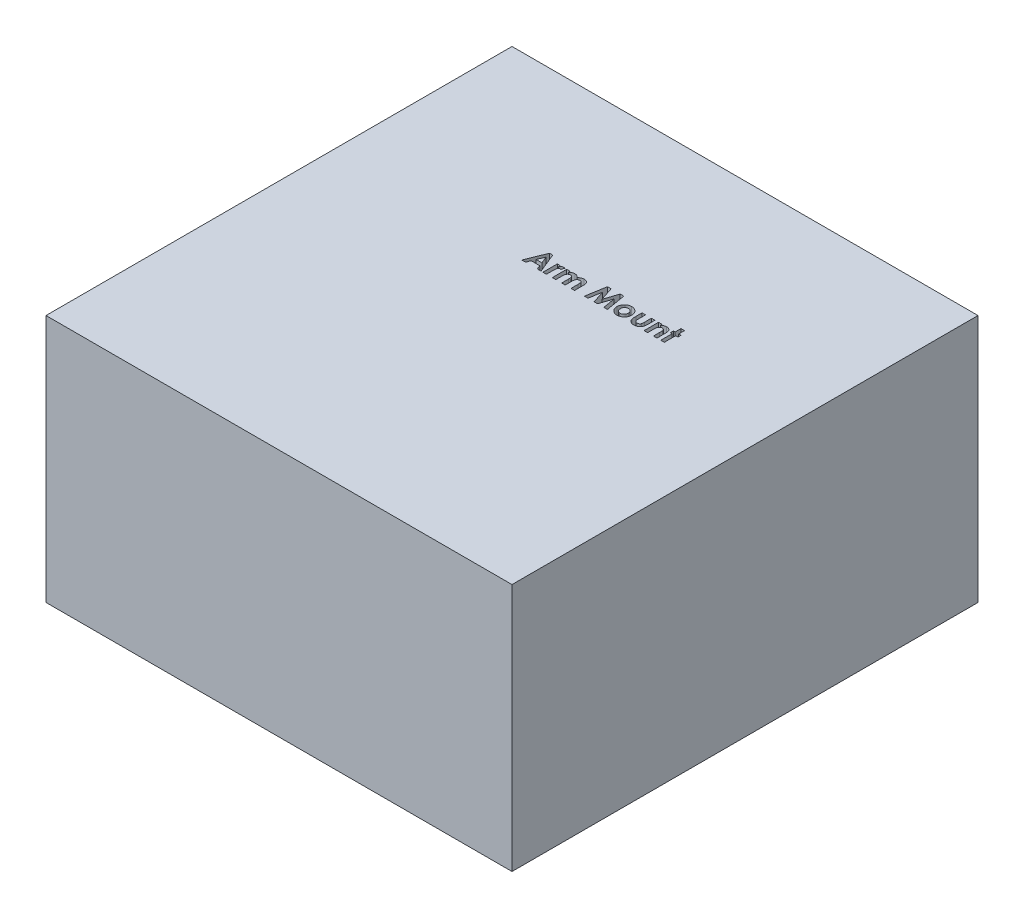
from build123d import *

# Parameters (mm, degrees)
SKETCH1_W           = 300
SKETCH1_H           = 300
BOSS_EXTRUDE1_DEPTH = 160
CUT_EXTRUDE1_DEPTH  = 160


with BuildPart() as part:
    # Sketch1 → Boss-Extrude1 (new body)
    with BuildSketch(Plane(origin=(0, 0, 0), x_dir=(1, 0, 0), z_dir=(0, 1, 0))):
        with Locations((150, 150)):
            Rectangle(SKETCH1_W, SKETCH1_H)
    extrude(amount=BOSS_EXTRUDE1_DEPTH)

    # Sketch2 → Cut-Extrude1 (cut)
    # profile 1 of 8: a face of its own
    with BuildSketch(Plane(origin=(0, 160, 0), x_dir=(1, 0, 0), z_dir=(0, 1, 0))):
        Polygon((127.3448054, 196.797186132), (129.458927996, 196.797186132), (134.58777415, 184.097186132), (132.153098669, 184.097186132), (131.16599931, 186.702314337), (125.632645945, 186.702314337), (124.645546586, 184.097186132), (122.213415176, 184.097186132), align=None)
        Polygon((128.400594663, 193.390675716), (126.497629919, 188.981801517), (130.303559407, 188.981801517), align=None, mode=Mode.SUBTRACT)
    # profile 2 of 8: a face of its own
    with BuildSketch(Plane(origin=(0, 160, 0), x_dir=(1, 0, 0), z_dir=(0, 1, 0))):
        with BuildLine():
            Line((135.808927996, 193.377955363), (137.76277415, 193.377955363))
            Line((137.76277415, 193.377955363), (137.76277415, 192.235667703))
            add(Edge.make_bspline(
                [(137.76277415, 192.235667703), (137.818044707, 192.337183121), (137.926073303, 192.535599219), (138.124530895, 192.801933536), (138.352527014, 193.026232868), (138.601869055, 193.213188638), (138.873312725, 193.358902303), (139.159589247, 193.46274166), (139.458249528, 193.530222852), (139.661985448, 193.537232872), (139.764957644, 193.540775876)],
                knots=[0, 0, 0, 0, 1.09866127, 2.147379032, 3.14564304, 4.131443017, 5.102343063, 6.064490016, 7.021754664, 8, 8, 8, 8], degree=3))
            add(Edge.make_bspline(
                [(139.764957644, 193.540775876), (139.839728307, 193.537274648), (139.991988075, 193.530144898), (140.224053389, 193.48869955), (140.459466997, 193.413758482), (140.614389438, 193.34628401), (140.693543381, 193.31180953)],
                knots=[0, 0, 0, 0, 0.931404136, 1.896671404, 2.925354185, 4, 4, 4, 4], degree=3))
            Line((140.693543381, 193.31180953), (139.986291778, 191.380860011))
            add(Edge.make_bspline(
                [(139.986291778, 191.380860011), (139.923073585, 191.411403985), (139.804247716, 191.468814899), (139.631733188, 191.536565693), (139.475169101, 191.577903916), (139.375910343, 191.584071941), (139.329921586, 191.586929722)],
                knots=[0, 0, 0, 0, 1.214386998, 2.282580073, 3.20428172, 4, 4, 4, 4], degree=3))
            add(Edge.make_bspline(
                [(139.329921586, 191.586929722), (139.286499256, 191.585036005), (139.201080051, 191.581310738), (139.075003695, 191.549386464), (138.956266021, 191.494334041), (138.839145068, 191.423806424), (138.73288038, 191.325767762), (138.626681329, 191.212270603), (138.533093039, 191.072143265), (138.434330252, 190.91617442), (138.35023727, 190.725268695), (138.278130127, 190.4973666), (138.213882084, 190.229831152), (138.169670659, 189.921241868), (138.126938541, 189.574584882), (138.101503335, 189.187315775), (138.082546155, 188.760659129), (138.08138705, 188.462837392), (138.080782964, 188.307622831)],
                knots=[0, 0, 0, 0, 0.544232178, 1.070598461, 1.618251235, 2.182094276, 2.777567932, 3.425210017, 4.127676488, 4.886675562, 5.738955394, 6.734782583, 7.883056018, 9.186093582, 10.642914445, 12.264202625, 14.053029461, 16, 16, 16, 16], degree=3))
            Line((138.080782964, 188.307622831), (138.088415176, 187.85477828))
            Line((138.088415176, 187.85477828), (138.088415176, 184.097186132))
            Line((138.088415176, 184.097186132), (135.808927996, 184.097186132))
            Line((135.808927996, 184.097186132), (135.808927996, 193.377955363))
        make_face()
    # profile 3 of 8: a face of its own
    with BuildSketch(Plane(origin=(0, 160, 0), x_dir=(1, 0, 0), z_dir=(0, 1, 0))):
        with BuildLine():
            Line((141.833286971, 193.377955363), (144.11277415, 193.377955363))
            Line((144.11277415, 193.377955363), (144.11277415, 192.26874062))
            add(Edge.make_bspline(
                [(144.11277415, 192.26874062), (144.214164582, 192.371072702), (144.413794008, 192.572556161), (144.744619019, 192.831581261), (145.089703004, 193.053079723), (145.453227834, 193.232396668), (145.834304342, 193.369318106), (146.231126425, 193.469652117), (146.645732325, 193.528846041), (146.928022906, 193.536755184), (147.071528157, 193.540775876)],
                knots=[0, 0, 0, 0, 1.041528618, 2.050684245, 3.032913108, 4.004406485, 4.976926473, 5.95771665, 6.961784757, 8, 8, 8, 8], degree=3))
            add(Edge.make_bspline(
                [(147.071528157, 193.540775876), (147.215222885, 193.536256037), (147.498081309, 193.52735888), (147.910769782, 193.445941555), (148.301726174, 193.313665913), (148.666649046, 193.125123238), (149.008175847, 192.892282835), (149.311176713, 192.603115435), (149.583913906, 192.269132165), (149.729293329, 192.016637222), (149.803859887, 191.887130043)],
                knots=[0, 0, 0, 0, 1.023965777, 2.015643508, 2.987309376, 3.958410333, 4.93654923, 5.924956801, 6.93568961, 8, 8, 8, 8], degree=3))
            add(Edge.make_bspline(
                [(149.803859887, 191.887130043), (149.89991125, 192.016989531), (150.088433122, 192.271867264), (150.42260531, 192.604639043), (150.783945146, 192.892312988), (151.179443725, 193.126842229), (151.598597974, 193.313022353), (152.039573727, 193.445450078), (152.498372951, 193.527222809), (152.810611, 193.536220656), (152.968683605, 193.540775876)],
                knots=[0, 0, 0, 0, 1.041189987, 2.043563759, 3.033412161, 4.015238574, 5.00275396, 5.986226558, 6.980513695, 8, 8, 8, 8], degree=3))
            add(Edge.make_bspline(
                [(152.968683605, 193.540775876), (153.131953835, 193.536045982), (153.449907431, 193.526834954), (153.910667849, 193.436214558), (154.342225738, 193.29619245), (154.735043787, 193.092426013), (155.090242353, 192.851056598), (155.39291438, 192.565868562), (155.644104507, 192.246813334), (155.807661492, 191.9488936), (155.913396688, 191.68549844), (155.977240539, 191.456295298), (156.036954292, 191.200361001), (156.079852648, 190.914255432), (156.119896371, 190.600667761), (156.143143327, 190.257513153), (156.158944524, 189.885947615), (156.160622811, 189.628863443), (156.161492099, 189.495703761)],
                knots=[0, 0, 0, 0, 1.321991808, 2.574456155, 3.791773975, 4.987670122, 6.148905103, 7.262530793, 8.344737981, 9.427709016, 10.004683293, 10.642050061, 11.354108788, 12.133887687, 12.985666279, 13.916212488, 14.92067847, 16, 16, 16, 16], degree=3))
            Line((156.161492099, 189.495703761), (156.161492099, 184.097186132))
            Line((156.161492099, 184.097186132), (153.882004919, 184.097186132))
            Line((153.882004919, 184.097186132), (153.882004919, 188.757923312))
            add(Edge.make_bspline(
                [(153.882004919, 188.757923312), (153.880107678, 188.882589368), (153.876466095, 189.121874597), (153.860984321, 189.465083575), (153.82632949, 189.7763445), (153.785709586, 190.057381467), (153.72758172, 190.306704386), (153.656705343, 190.524914281), (153.574489176, 190.712325258), (153.475215633, 190.868917783), (153.364029147, 191.000793424), (153.240350222, 191.113836965), (153.105468398, 191.210285475), (152.958160775, 191.292494122), (152.794568269, 191.348093459), (152.620213506, 191.391718682), (152.433732107, 191.421427771), (152.30479891, 191.42319894), (152.238535368, 191.424109209)],
                knots=[0, 0, 0, 0, 1.669139205, 3.203761885, 4.596586177, 5.860166715, 7.002923539, 8.018877315, 8.928339525, 9.734594377, 10.491888885, 11.231098709, 11.971440889, 12.708030942, 13.480072485, 14.275788656, 15.113863979, 16, 16, 16, 16], degree=3))
            add(Edge.make_bspline(
                [(152.238535368, 191.424109209), (152.136424189, 191.420578961), (151.936051319, 191.413651552), (151.644067208, 191.347452397), (151.369308009, 191.239223864), (151.112803081, 191.091988531), (150.880071842, 190.908094383), (150.676490922, 190.689978388), (150.508361473, 190.436383526), (150.39197817, 190.201098362), (150.319253224, 189.988353297), (150.267952385, 189.806154234), (150.22796542, 189.600114043), (150.196667335, 189.372319435), (150.166640476, 189.121482665), (150.151909467, 188.847920923), (150.13683515, 188.552014254), (150.137031386, 188.347504678), (150.137133125, 188.241476998)],
                knots=[0, 0, 0, 0, 1.129913425, 2.217230253, 3.297175357, 4.391411011, 5.481605898, 6.571841268, 7.681894157, 8.841607612, 9.468549532, 10.170608623, 10.93710061, 11.791434153, 12.717934886, 13.734733707, 14.825576123, 16, 16, 16, 16], degree=3))
            Line((150.137133125, 188.241476998), (150.137133125, 184.097186132))
            Line((150.137133125, 184.097186132), (147.857645945, 184.097186132))
            Line((147.857645945, 184.097186132), (147.857645945, 188.546765459))
            add(Edge.make_bspline(
                [(147.857645945, 188.546765459), (147.857454559, 188.645996937), (147.857086393, 188.836886157), (147.846020075, 189.112533843), (147.831366108, 189.367056681), (147.810822953, 189.601164578), (147.787130468, 189.814566362), (147.752936753, 190.006094578), (147.717013101, 190.176804604), (147.655421513, 190.370726099), (147.568631046, 190.585623569), (147.438964819, 190.81351037), (147.282180641, 191.00431186), (147.102241223, 191.159512881), (146.898901959, 191.277763605), (146.677314067, 191.365727447), (146.433246463, 191.413207629), (146.265246642, 191.420398664), (146.178559407, 191.424109209)],
                knots=[0, 0, 0, 0, 1.256487322, 2.417074606, 3.49288742, 4.484586665, 5.393016842, 6.210437544, 6.947749329, 7.599905853, 8.784490193, 9.876739139, 10.906602197, 11.896672079, 12.869113195, 13.872201355, 14.902064413, 16, 16, 16, 16], degree=3))
            add(Edge.make_bspline(
                [(146.178559407, 191.424109209), (146.08061029, 191.420784646), (145.886621245, 191.414200322), (145.604046566, 191.343479295), (145.333878968, 191.237236553), (145.082061861, 191.085894605), (144.852836733, 190.897672865), (144.65129409, 190.673352745), (144.484048226, 190.413200323), (144.367148319, 190.171425152), (144.29548379, 189.953372391), (144.242803546, 189.766442357), (144.20430435, 189.555864698), (144.172182718, 189.324003826), (144.142333629, 189.070586055), (144.127541668, 188.794496954), (144.112482246, 188.496042544), (144.112674504, 188.289838596), (144.11277415, 188.182963376)],
                knots=[0, 0, 0, 0, 1.07893236, 2.136834559, 3.195274846, 4.273923004, 5.364443877, 6.458052972, 7.587287137, 8.767908, 9.410170275, 10.118584836, 10.909717261, 11.770069756, 12.702352573, 13.724628867, 14.820678298, 16, 16, 16, 16], degree=3))
            Line((144.11277415, 188.182963376), (144.11277415, 184.097186132))
            Line((144.11277415, 184.097186132), (141.833286971, 184.097186132))
            Line((141.833286971, 184.097186132), (141.833286971, 193.377955363))
        make_face()
    # profile 4 of 8: a face of its own
    with BuildSketch(Plane(origin=(0, 160, 0), x_dir=(1, 0, 0), z_dir=(0, 1, 0))):
        Polygon((164.656143541, 196.797186132), (167.022129118, 196.797186132), (169.919825432, 187.938732607), (172.83787431, 196.797186132), (175.180963253, 196.797186132), (177.328158766, 184.097186132), (175.02068681, 184.097186132), (173.664697227, 192.118640459), (171.023952035, 184.097186132), (168.800434407, 184.097186132), (166.174953637, 192.118640459), (164.821508125, 184.097186132), (162.511492099, 184.097186132), align=None)
    # profile 5 of 8: a face of its own
    with BuildSketch(Plane(origin=(0, 160, 0), x_dir=(1, 0, 0), z_dir=(0, 1, 0))):
        with BuildLine():
            add(Edge.make_bspline(
                [(183.540778958, 193.540775876), (183.648548711, 193.538858039), (183.861981655, 193.535059854), (184.179863363, 193.50344343), (184.492187765, 193.451859931), (184.800750061, 193.385068303), (185.102684962, 193.291483243), (185.399576079, 193.179242434), (185.694077997, 193.050376859), (185.978881236, 192.896981751), (186.256043287, 192.730610766), (186.518809407, 192.54708992), (186.764997503, 192.347860704), (186.999177665, 192.137542407), (187.21043672, 191.906978456), (187.412275254, 191.667278387), (187.593788423, 191.409854585), (187.761843471, 191.140979873), (187.911461671, 190.862209099), (188.041377562, 190.575481494), (188.154132341, 190.284761268), (188.242417073, 189.986507251), (188.315508693, 189.684652317), (188.361634701, 189.375497461), (188.394427094, 189.06221848), (188.398104161, 188.851293289), (188.399953637, 188.745202959)],
                knots=[0, 0, 0, 0, 1.022364134, 2.024744242, 3.027414945, 4.024939316, 5.017584196, 6.023349371, 7.035562955, 8.064994934, 9.090267829, 10.101425541, 11.102933353, 12.093946398, 13.084502048, 14.067315274, 15.065326281, 16.070028806, 17.074376865, 18.064572984, 19.055292013, 20.030201733, 21.013838017, 21.999348303, 22.993720005, 24, 24, 24, 24], degree=3))
            add(Edge.make_bspline(
                [(188.399953637, 188.745202959), (188.398001821, 188.638283798), (188.394121168, 188.425704268), (188.362821089, 188.109478511), (188.311040145, 187.798869844), (188.243992168, 187.492048418), (188.150757329, 187.192940308), (188.041822372, 186.897136541), (187.908100427, 186.608669034), (187.760260963, 186.324390878), (187.591125392, 186.05266751), (187.409769344, 185.792664943), (187.208776209, 185.551204265), (186.999208341, 185.320797108), (186.771125464, 185.109234811), (186.528168204, 184.913082167), (186.272439898, 184.729941122), (186.002101589, 184.56410851), (185.720615859, 184.418397307), (185.432729913, 184.287026767), (185.136760353, 184.177651412), (184.833319704, 184.088458822), (184.522223941, 184.019399232), (184.204159881, 183.972486231), (183.879812518, 183.93985878), (183.661280036, 183.936208461), (183.55095524, 183.93436562)],
                knots=[0, 0, 0, 0, 1.012026251, 2.012137606, 3.004615893, 3.992048833, 4.982446996, 5.968083444, 6.973977695, 7.990229942, 8.999482246, 10.001782172, 10.988562221, 11.971415814, 12.948383116, 13.930088534, 14.925840678, 15.924049238, 16.929462851, 17.924729459, 18.917889337, 19.913673841, 20.916777188, 21.931792057, 22.95587778, 24, 24, 24, 24], degree=3))
            add(Edge.make_bspline(
                [(183.55095524, 183.93436562), (183.389637891, 183.939100602), (183.07167894, 183.948433324), (182.603400579, 184.012360029), (182.153539656, 184.12239465), (181.721363127, 184.275780484), (181.306309584, 184.472338715), (180.912001283, 184.715609375), (180.534515932, 185.000803161), (180.18039186, 185.32550959), (179.855966238, 185.681741947), (179.572541424, 186.062017817), (179.33189082, 186.460637504), (179.134230941, 186.878055569), (178.98167782, 187.314844406), (178.871508438, 187.769698167), (178.807503575, 188.243895382), (178.798249786, 188.566078648), (178.793543381, 188.729938536)],
                knots=[0, 0, 0, 0, 1.029999031, 2.030143771, 3.011211297, 3.982305373, 4.953580601, 5.938004764, 6.935448627, 7.970290061, 9.001484052, 10.007591832, 10.993831261, 11.969999897, 12.951306496, 13.942897864, 14.953773953, 16, 16, 16, 16], degree=3))
            add(Edge.make_bspline(
                [(178.793543381, 188.729938536), (178.798413912, 188.904904976), (178.807986844, 189.248798011), (178.884000136, 189.752609144), (179.005385162, 190.234984428), (179.179625721, 190.694574504), (179.402202711, 191.132227027), (179.673918772, 191.547018937), (179.996116743, 191.93904419), (180.242855871, 192.176154503), (180.368323028, 192.296725395)],
                knots=[0, 0, 0, 0, 1.043912699, 2.05178951, 3.033892, 4.007821512, 4.978932272, 5.95884105, 6.962068106, 8, 8, 8, 8], degree=3))
            add(Edge.make_bspline(
                [(180.368323028, 192.296725395), (180.483451686, 192.396665103), (180.710576696, 192.593825457), (181.079580083, 192.843891044), (181.457397914, 193.05987142), (181.848558495, 193.23744746), (182.254152284, 193.371336929), (182.672100841, 193.468796483), (183.102317261, 193.528658997), (183.393882322, 193.536716391), (183.540778958, 193.540775876)],
                knots=[0, 0, 0, 0, 1.048115528, 2.067714963, 3.060638214, 4.039924844, 5.017819947, 5.994373833, 6.98952318, 8, 8, 8, 8], degree=3))
        make_face()
        with BuildLine():
            add(Edge.make_bspline(
                [(183.591660368, 191.424109209), (183.50340488, 191.421175889), (183.329673001, 191.415401617), (183.073935112, 191.38441264), (182.832055523, 191.320898071), (182.599230054, 191.240124922), (182.379577413, 191.132102216), (182.167082094, 191.005690756), (181.972793387, 190.847502369), (181.78730904, 190.673981281), (181.618930598, 190.48129077), (181.475456176, 190.271354603), (181.347258602, 190.052204497), (181.250052882, 189.815817093), (181.169605857, 189.568653546), (181.115160275, 189.306720445), (181.077269952, 189.032943724), (181.074457132, 188.845404794), (181.07303056, 188.7502911)],
                knots=[0, 0, 0, 0, 1.030650113, 2.02884584, 2.99876339, 3.944280128, 4.900564847, 5.851248946, 6.823638398, 7.81794922, 8.81432732, 9.802856497, 10.78262424, 11.771747962, 12.779760563, 13.812642396, 14.89064281, 16, 16, 16, 16], degree=3))
            add(Edge.make_bspline(
                [(181.07303056, 188.7502911), (181.074699843, 188.651823219), (181.077962135, 188.459386655), (181.111743852, 188.178403394), (181.167451017, 187.911752142), (181.24659344, 187.659844817), (181.3461284, 187.42087326), (181.468246253, 187.196178262), (181.614235817, 186.987110828), (181.779752549, 186.793928408), (181.960986301, 186.618574589), (182.159568078, 186.468092502), (182.367182023, 186.337343541), (182.588612688, 186.232331945), (182.820715123, 186.151254472), (183.064178344, 186.091559857), (183.32028175, 186.059399292), (183.4949038, 186.053859638), (183.584028157, 186.051032286)],
                knots=[0, 0, 0, 0, 1.141730614, 2.231293227, 3.276944405, 4.297399982, 5.28939179, 6.275415646, 7.257752684, 8.24146775, 9.222424823, 10.176631434, 11.126518621, 12.063689483, 13.012557477, 13.974037417, 14.965980454, 16, 16, 16, 16], degree=3))
            add(Edge.make_bspline(
                [(183.584028157, 186.051032286), (183.673197089, 186.05354002), (183.84801996, 186.058456634), (184.104424112, 186.095274307), (184.349130635, 186.153218067), (184.583215406, 186.234993345), (184.804785829, 186.342252658), (185.014690093, 186.47362714), (185.214774753, 186.626202297), (185.39844068, 186.80486471), (185.568456716, 186.998649596), (185.717550611, 187.208820683), (185.842139092, 187.433515738), (185.944323955, 187.671320979), (186.023621525, 187.921909544), (186.078406446, 188.186212839), (186.116317028, 188.463411768), (186.119066233, 188.653483667), (186.120466458, 188.7502911)],
                knots=[0, 0, 0, 0, 1.031504075, 2.022346795, 2.991027682, 3.937587355, 4.885570121, 5.833146507, 6.798790848, 7.791235734, 8.792807298, 9.778388351, 10.766749885, 11.760164525, 12.768777521, 13.802286646, 14.880660483, 16, 16, 16, 16], degree=3))
            add(Edge.make_bspline(
                [(186.120466458, 188.7502911), (186.11877594, 188.847064698), (186.115458596, 189.036965891), (186.081674471, 189.314539728), (186.026514001, 189.577988721), (185.946350815, 189.826187964), (185.847407477, 190.061969018), (185.725205217, 190.284125007), (185.578495678, 190.491561756), (185.412174323, 190.683250678), (185.228223764, 190.856143885), (185.033089845, 191.010322655), (184.822310454, 191.137840343), (184.59983994, 191.242960438), (184.365086413, 191.323835345), (184.118313424, 191.383868266), (183.858764691, 191.4155712), (183.681625663, 191.421233462), (183.591660368, 191.424109209)],
                knots=[0, 0, 0, 0, 1.123894411, 2.205445421, 3.243160173, 4.246488011, 5.231014757, 6.210004299, 7.185865357, 8.177612767, 9.153374344, 10.115157457, 11.061423229, 12.009021698, 12.96873347, 13.94135618, 14.954456845, 16, 16, 16, 16], degree=3))
        make_face(mode=Mode.SUBTRACT)
    # profile 6 of 8: a face of its own
    with BuildSketch(Plane(origin=(0, 160, 0), x_dir=(1, 0, 0), z_dir=(0, 1, 0))):
        with BuildLine():
            Line((190.353799791, 193.377955363), (192.633286971, 193.377955363))
            Line((192.633286971, 193.377955363), (192.633286971, 188.923287895))
            add(Edge.make_bspline(
                [(192.633286971, 188.923287895), (192.63348939, 188.818970336), (192.633877883, 188.618759464), (192.644688368, 188.331217456), (192.659857615, 188.068273456), (192.67878781, 187.829617406), (192.707042338, 187.615823353), (192.739661, 187.427299435), (192.77664004, 187.262687316), (192.836772628, 187.079205161), (192.930851149, 186.878419233), (193.072926367, 186.66526139), (193.245020897, 186.480942183), (193.444809623, 186.323825874), (193.674332881, 186.200014772), (193.930428441, 186.116109878), (194.209874098, 186.059717065), (194.404507581, 186.054003508), (194.505722868, 186.051032286)],
                knots=[0, 0, 0, 0, 1.267339619, 2.432334223, 3.495366327, 4.467371443, 5.340232306, 6.114347373, 6.791623365, 7.387877112, 8.457231658, 9.474542289, 10.487879852, 11.508108106, 12.54995813, 13.638205937, 14.771795776, 16, 16, 16, 16], degree=3))
            add(Edge.make_bspline(
                [(194.505722868, 186.051032286), (194.606848336, 186.054423516), (194.801985173, 186.060967404), (195.08329009, 186.111998387), (195.339988855, 186.199441676), (195.574717927, 186.318048178), (195.780555133, 186.476782779), (195.959769169, 186.665926317), (196.110663182, 186.888529909), (196.183174714, 187.054585811), (196.220426394, 187.139894466)],
                knots=[0, 0, 0, 0, 1.116871431, 2.155171802, 3.144773418, 4.104381479, 5.046960687, 6.001340237, 6.973219418, 8, 8, 8, 8], degree=3))
            add(Edge.make_bspline(
                [(196.220426394, 187.139894466), (196.234096509, 187.177789335), (196.264271711, 187.261437889), (196.291128237, 187.405743155), (196.320033858, 187.575927852), (196.34289923, 187.775460201), (196.355837264, 188.003104477), (196.369699043, 188.259147592), (196.376763255, 188.543334543), (196.377679351, 188.742656176), (196.378158766, 188.84696578)],
                knots=[0, 0, 0, 0, 0.56094539, 1.238222264, 2.041156151, 2.969685991, 4.036367568, 5.220421584, 6.545382566, 8, 8, 8, 8], degree=3))
            Line((196.378158766, 188.84696578), (196.378158766, 193.377955363))
            Line((196.378158766, 193.377955363), (198.657645945, 193.377955363))
            Line((198.657645945, 193.377955363), (198.657645945, 189.477895267))
            add(Edge.make_bspline(
                [(198.657645945, 189.477895267), (198.657251254, 189.284522017), (198.656494512, 188.913766968), (198.634806749, 188.381930899), (198.604875178, 187.898385762), (198.566329073, 187.461800203), (198.510788898, 187.071993036), (198.442610374, 186.729878372), (198.367183159, 186.433195469), (198.298013592, 186.257408798), (198.265859086, 186.175691741)],
                knots=[0, 0, 0, 0, 1.388070971, 2.661352173, 3.82033814, 4.865898334, 5.806910977, 6.645039373, 7.370126333, 8, 8, 8, 8], degree=3))
            add(Edge.make_bspline(
                [(198.265859086, 186.175691741), (198.224645292, 186.087738941), (198.143292802, 185.914127669), (198.002131111, 185.667290889), (197.8499509, 185.433432595), (197.679511378, 185.218057582), (197.494291744, 185.01897691), (197.299527574, 184.83166499), (197.086447703, 184.663749446), (196.860578078, 184.510909338), (196.618767002, 184.375234463), (196.362670705, 184.255003543), (196.089521659, 184.15715619), (195.80168839, 184.074216758), (195.497844174, 184.012364558), (195.178601071, 183.965516235), (194.843608948, 183.941304843), (194.615150525, 183.936716594), (194.498090657, 183.93436562)],
                knots=[0, 0, 0, 0, 0.997311338, 1.968606903, 2.91805772, 3.860812155, 4.785445165, 5.709667791, 6.633356648, 7.568312411, 8.508286151, 9.478643871, 10.470653671, 11.485274776, 12.552984541, 13.653035246, 14.797438149, 16, 16, 16, 16], degree=3))
            add(Edge.make_bspline(
                [(194.498090657, 183.93436562), (194.371633105, 183.93587266), (194.124198558, 183.938821427), (193.762700141, 183.974932265), (193.41818729, 184.021654996), (193.094506469, 184.101092202), (192.787137326, 184.193124178), (192.49960863, 184.31058146), (192.230745468, 184.448677943), (191.980018816, 184.606594916), (191.749373217, 184.785779518), (191.533680011, 184.97848632), (191.339902698, 185.192382514), (191.161715241, 185.420862902), (191.001106309, 185.666030301), (190.857996188, 185.927012968), (190.732263656, 186.204997987), (190.665179113, 186.399825791), (190.631103477, 186.498788696)],
                knots=[0, 0, 0, 0, 1.211240017, 2.369985978, 3.478996442, 4.539426614, 5.559871561, 6.551301256, 7.510778031, 8.453136967, 9.386094087, 10.30661716, 11.221130616, 12.147659962, 13.080758632, 14.026335491, 14.997475882, 16, 16, 16, 16], degree=3))
            add(Edge.make_bspline(
                [(190.631103477, 186.498788696), (190.607855968, 186.575647077), (190.557775412, 186.741217945), (190.503703757, 187.016377402), (190.460455281, 187.333514083), (190.41838453, 187.692939937), (190.389035206, 188.09525754), (190.369852139, 188.539827961), (190.356890734, 189.027520554), (190.354860459, 189.366795211), (190.353799791, 189.5440411)],
                knots=[0, 0, 0, 0, 0.627914866, 1.352675004, 2.190563461, 3.132055958, 4.183353232, 5.345633452, 6.613289997, 8, 8, 8, 8], degree=3))
            Line((190.353799791, 189.5440411), (190.353799791, 193.377955363))
        make_face()
    # profile 7 of 8: a face of its own
    with BuildSketch(Plane(origin=(0, 160, 0), x_dir=(1, 0, 0), z_dir=(0, 1, 0))):
        with BuildLine():
            Line((200.937133125, 193.377955363), (203.216620304, 193.377955363))
            Line((203.216620304, 193.377955363), (203.216620304, 192.395944145))
            add(Edge.make_bspline(
                [(203.216620304, 192.395944145), (203.346663918, 192.497094746), (203.595202543, 192.690413208), (203.973024166, 192.936895232), (204.329640999, 193.138630871), (204.673002416, 193.292081321), (205.009568768, 193.402482322), (205.344790991, 193.481798855), (205.683661221, 193.532587411), (205.911464272, 193.538047852), (206.02527415, 193.540775876)],
                knots=[0, 0, 0, 0, 1.276643801, 2.439914479, 3.493451431, 4.44993799, 5.350072675, 6.235028322, 7.118224225, 8, 8, 8, 8], degree=3))
            add(Edge.make_bspline(
                [(206.02527415, 193.540775876), (206.140718956, 193.53765831), (206.367346806, 193.531538265), (206.701043827, 193.488733512), (207.019858923, 193.410772497), (207.327376908, 193.307261355), (207.620467775, 193.170632584), (207.902722065, 193.008408087), (208.168077056, 192.810807673), (208.331494407, 192.660324684), (208.414156362, 192.584205363)],
                knots=[0, 0, 0, 0, 1.048836932, 2.058954983, 3.049370783, 4.026390553, 5.001981509, 5.982488534, 6.97947532, 8, 8, 8, 8], degree=3))
            add(Edge.make_bspline(
                [(208.414156362, 192.584205363), (208.480454292, 192.513665011), (208.613535374, 192.372068036), (208.781001194, 192.129759345), (208.924705706, 191.86559852), (209.042451584, 191.576538381), (209.129461046, 191.260990729), (209.196398611, 190.92276693), (209.233958447, 190.559973178), (209.238595385, 190.310737295), (209.240979278, 190.182602799)],
                knots=[0, 0, 0, 0, 0.889584746, 1.785680191, 2.700364693, 3.65222533, 4.649950538, 5.707241244, 6.821271309, 8, 8, 8, 8], degree=3))
            Line((209.240979278, 190.182602799), (209.240979278, 184.097186132))
            Line((209.240979278, 184.097186132), (206.961492099, 184.097186132))
            Line((206.961492099, 184.097186132), (206.961492099, 188.126993825))
            add(Edge.make_bspline(
                [(206.961492099, 188.126993825), (206.961010038, 188.258439131), (206.960086257, 188.510329664), (206.952993664, 188.870822873), (206.939144791, 189.196395054), (206.926521905, 189.487638982), (206.90173816, 189.743520545), (206.879387779, 189.965659669), (206.845093285, 190.15204109), (206.800470586, 190.352522274), (206.722548362, 190.567174043), (206.601577909, 190.793345143), (206.448109925, 190.985482536), (206.268412657, 191.144933198), (206.062684563, 191.271073297), (205.833411571, 191.359820714), (205.581822856, 191.415130283), (205.406518796, 191.421040084), (205.315478477, 191.424109209)],
                knots=[0, 0, 0, 0, 1.49886392, 2.872294502, 4.110984203, 5.214877267, 6.195405875, 7.042225351, 7.75923308, 8.355011229, 9.382752534, 10.352059385, 11.267231453, 12.171456522, 13.078624015, 14.003401117, 14.963110155, 16, 16, 16, 16], degree=3))
            add(Edge.make_bspline(
                [(205.315478477, 191.424109209), (205.197076713, 191.418105024), (204.965459844, 191.406359671), (204.630472379, 191.317788991), (204.322791974, 191.167156336), (204.04493263, 190.95871103), (203.799540727, 190.701359472), (203.597429444, 190.394438217), (203.431656673, 190.045354791), (203.360371917, 189.790467188), (203.323471266, 189.658524273)],
                knots=[0, 0, 0, 0, 0.984188326, 1.925263693, 2.85911992, 3.81709677, 4.80007086, 5.801799564, 6.862098548, 8, 8, 8, 8], degree=3))
            add(Edge.make_bspline(
                [(203.323471266, 189.658524273), (203.314299988, 189.617086717), (203.293846194, 189.524672634), (203.277025537, 189.368549144), (203.253626781, 189.183323738), (203.244859843, 188.965644358), (203.229615101, 188.716541191), (203.223976867, 188.435684679), (203.218328545, 188.123625533), (203.217208582, 187.905664078), (203.216620304, 187.791176517)],
                knots=[0, 0, 0, 0, 0.543362196, 1.211806945, 2.009705693, 2.934833164, 4.000995085, 5.207458376, 6.533175157, 8, 8, 8, 8], degree=3))
            Line((203.216620304, 187.791176517), (203.216620304, 184.097186132))
            Line((203.216620304, 184.097186132), (200.937133125, 184.097186132))
            Line((200.937133125, 184.097186132), (200.937133125, 193.377955363))
        make_face()
    # profile 8 of 8: a face of its own
    with BuildSketch(Plane(origin=(0, 160, 0), x_dir=(1, 0, 0), z_dir=(0, 1, 0))):
        Polygon((211.683286971, 197.122827158), (213.96277415, 197.122827158), (213.96277415, 193.377955363), (215.428158766, 193.377955363), (215.428158766, 191.424109209), (213.96277415, 191.424109209), (213.96277415, 184.097186132), (211.683286971, 184.097186132), (211.683286971, 191.424109209), (210.543543381, 191.424109209), (210.543543381, 193.377955363), (211.683286971, 193.377955363), align=None)
    extrude(amount=-CUT_EXTRUDE1_DEPTH, mode=Mode.SUBTRACT)


with BuildPart() as cut_extrude1_piece_1:
    # of the separate pieces the step leaves, piece 1, a body of its own (cut_extrude1_pieces)
    add(part.part.solids().sort_by_distance((0, 0, 0))[0])


with BuildPart() as cut_extrude1_piece_2:
    # of the separate pieces the step leaves, piece 2, a body of its own (cut_extrude1_pieces)
    add(part.part.solids().sort_by_distance((186.120466458, 0, -188.7502911))[0])


with BuildPart() as cut_extrude1_piece_3:
    # of the separate pieces the step leaves, piece 3, a body of its own (cut_extrude1_pieces)
    add(part.part.solids().sort_by_distance((130.303559407, 0, -188.981801517))[0])


solid = Compound([cut_extrude1_piece_1.part, cut_extrude1_piece_2.part, cut_extrude1_piece_3.part])
